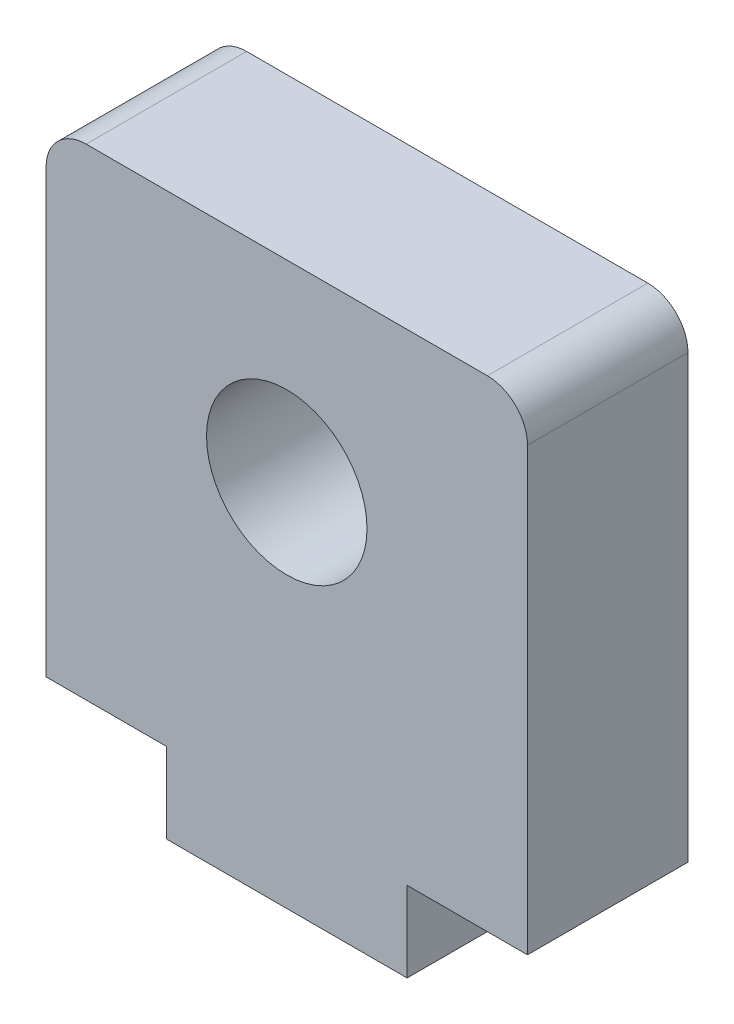
from build123d import *

# Parameters (mm, degrees)
SKETCH1_R           = 3.175
BOSS_EXTRUDE1_DEPTH = 6.35
FILLET1_R           = 1.5875


with BuildPart() as part:
    # Sketch1 → Boss-Extrude1 (new body)
    with BuildSketch(Plane.XY):
        Polygon((9.525, 11.1125), (-9.525, 11.1125), (-9.525, -7.9375), (-4.7625, -7.9375), (-4.7625, -11.1125), (4.7625, -11.1125), (4.7625, -7.9375), (9.525, -7.9375), align=None)
        with Locations((0, 3.4925)):
            Circle(SKETCH1_R, mode=Mode.SUBTRACT)
    extrude(amount=BOSS_EXTRUDE1_DEPTH)

    # Fillet1
    fillet1_edges = [part.edges().sort_by_distance(p)[0] for p in [
        (9.525, 11.1125, 3.175),
        (-9.525, 11.1125, 3.175),
    ]]
    fillet(fillet1_edges, radius=FILLET1_R)


solid = part.part
